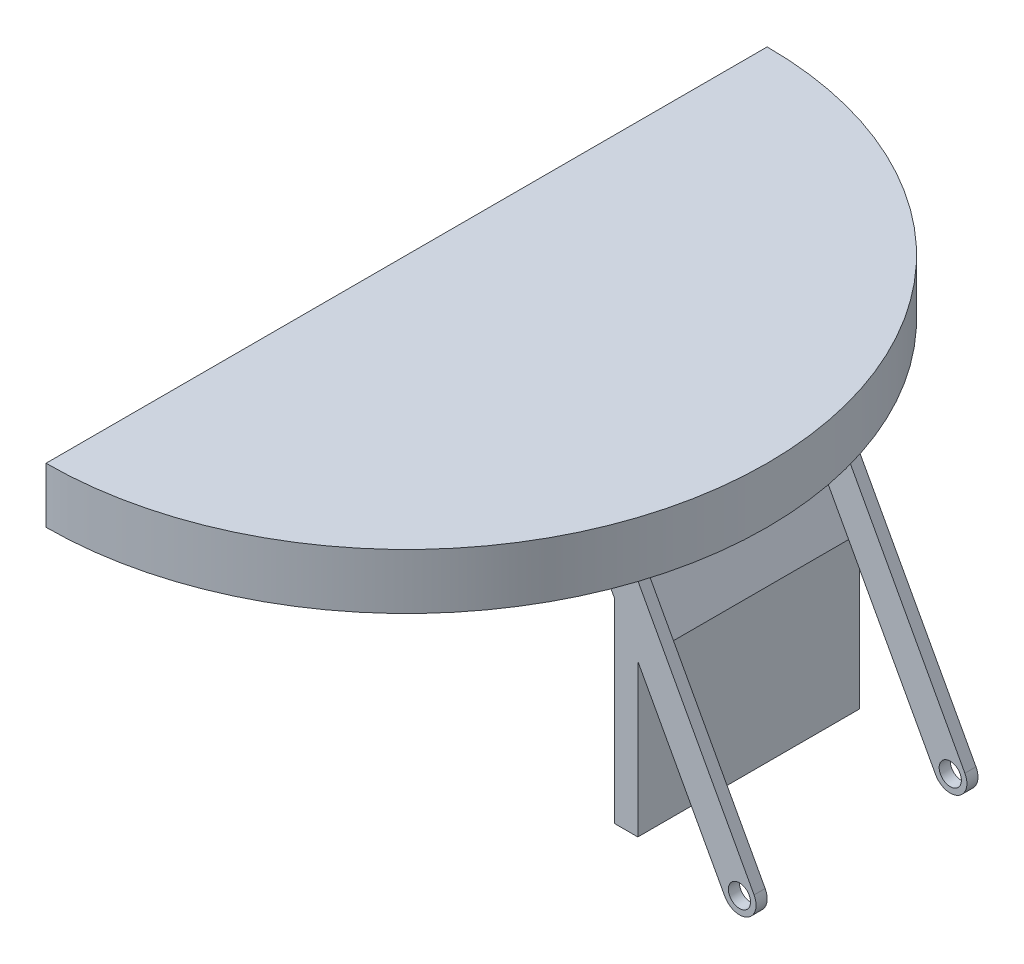
from build123d import *

# Parameters (mm, degrees)
AUFSATZ_LINEAR_AUSTRAGEN1_DEPTH = 5
SKIZZE3_W                       = 2.117867818
SKIZZE3_H                       = 20
AUFSATZ_LINEAR_AUSTRAGEN2_DEPTH = 20
SKIZZE5_R                       = 1.5
SKIZZE5_R_2                     = 1
AUFSATZ_LINEAR_AUSTRAGEN4_DEPTH = 20
SKIZZE14_R                      = 1.5
SCHNITT_LINEAR_AUSTRAGEN1_DEPTH = 18
AUFSATZ_LINEAR_AUSTRAGEN6_DEPTH = 20
SCHNITT_LINEAR_AUSTRAGEN2_DEPTH = 18


with BuildPart() as part:
    # Skizze1 → Aufsatz-Linear austragen1 (new body)
    with BuildSketch(Plane(origin=(0, 0, 0), x_dir=(1, 0, 0), z_dir=(0, 1, 0))):
        with BuildLine():
            Line((0, 0), (0, -65))
            ThreePointArc((0, -65), (32.5, -32.5), (0, 0))
        make_face()
    extrude(amount=AUFSATZ_LINEAR_AUSTRAGEN1_DEPTH)

    # Skizze3 → Aufsatz-Linear austragen2 (add)
    with BuildSketch(Plane.XZ):
        with Locations((29.782013558, 32.5)):
            Rectangle(SKIZZE3_W, SKIZZE3_H)
    extrude(amount=AUFSATZ_LINEAR_AUSTRAGEN2_DEPTH)


with BuildPart() as body_2:
    # Skizze5 → Aufsatz-Linear austragen4 (new body)
    with BuildSketch(Plane(origin=(0, 0.692290062, 22.5), x_dir=(-1, 0, 0), z_dir=(0, 0, -1))):
        with Locations((-40, -20.692290062)):
            Circle(SKIZZE5_R)
        with Locations((-40, -20.692290062)):
            Circle(SKIZZE5_R_2, mode=Mode.SUBTRACT)
    extrude(amount=-AUFSATZ_LINEAR_AUSTRAGEN4_DEPTH)

    # Skizze14 → Schnitt-Linear austragen1 (cut)
    with BuildSketch(Plane(origin=(0, 0, 23.5), x_dir=(-1, 0, 0), z_dir=(0, 0, -1))):
        with Locations((-40, -20)):
            Circle(SKIZZE14_R)
    extrude(amount=-SCHNITT_LINEAR_AUSTRAGEN1_DEPTH, mode=Mode.SUBTRACT)


with BuildPart() as schnitt_linear_austragen1_piece_1:
    # of the separate pieces the step leaves, piece 1, a body of its own (schnitt_linear_austragen1_pieces)
    add(body_2.part.solids().sort_by_distance((38.5, -20, 22.5))[0])


with BuildPart() as schnitt_linear_austragen1_piece_2:
    # of the separate pieces the step leaves, piece 2, a body of its own (schnitt_linear_austragen1_pieces)
    add(body_2.part.solids().sort_by_distance((38.5, -20, 41.5))[0])


with BuildPart() as aufsatz_linear_austragen6_tool:
    # Skizze15 → Aufsatz-Linear austragen6 (new body)
    with BuildSketch(Plane(origin=(0, 0, 22.5), x_dir=(-1, 0, 0), z_dir=(0, 0, -1))):
        with BuildLine():
            Line((-30.840947467, 0), (-41.318027779, -19.283897512))
            ThreePointArc((-41.318027779, -19.283897512), (-39.283893942, -18.681965651), (-38.681972221, -20.716102488))
            Line((-38.681972221, -20.716102488), (-27.426497141, 0))
            Line((-27.426497141, 0), (-30.840947467, 0))
        make_face()
    extrude(amount=-AUFSATZ_LINEAR_AUSTRAGEN6_DEPTH)


with BuildPart() as part_1:
    add(part.part)


with BuildPart() as part_2:
    # Aufsatz-Linear austragen6: joined with aufsatz_linear_austragen6_tool
    add(part_1.part.fuse(aufsatz_linear_austragen6_tool.part, schnitt_linear_austragen1_piece_1.part, schnitt_linear_austragen1_piece_2.part, tol=0.00001))

    # Skizze16 → Schnitt-Linear austragen2 (cut)
    with BuildSketch(Plane(origin=(0, 0, 23.5), x_dir=(-1, 0, 0), z_dir=(0, 0, -1))):
        with BuildLine():
            Line((-41.318027779, -19.283897512), (-30.840947467, 0))
            Line((-30.840947467, 0), (-27.426497141, 0))
            Line((-27.426497141, 0), (-38.681975791, -20.716109058))
            ThreePointArc((-38.681975791, -20.716109058), (-39.283894227, -18.681974006), (-41.318027779, -19.283897512))
        make_face()
    extrude(amount=-SCHNITT_LINEAR_AUSTRAGEN2_DEPTH, mode=Mode.SUBTRACT)


solid = part_2.part
